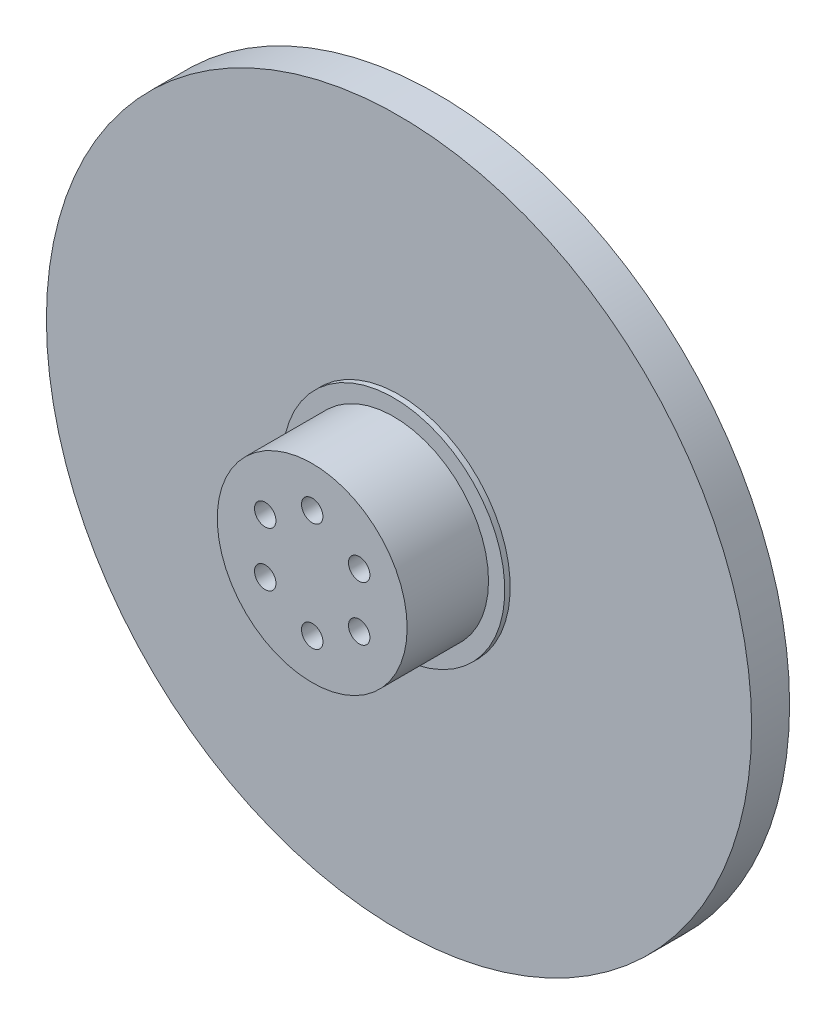
from build123d import *

# Parameters (mm, degrees)
SKETCH1_R           = 17.5
BOSS_EXTRUDE1_DEPTH = 15
SKETCH7_R           = 20.5
BOSS_EXTRUDE3_DEPTH = 1
SKETCH3_R           = 65
BOSS_EXTRUDE2_DEPTH = 7
SKETCH4_R           = 11
CUT_EXTRUDE1_DEPTH  = 7
SKETCH5_R           = 7.5
CUT_EXTRUDE2_DEPTH  = 0.5
SKETCH6_R           = 1.975
CUT_EXTRUDE3_DEPTH  = 6
CIRPATTERN1_COUNT   = 6


with BuildPart() as part:
    # Sketch1 → Boss-Extrude1 (new body)
    with BuildSketch(Plane.XY):
        Circle(SKETCH1_R)
    extrude(amount=BOSS_EXTRUDE1_DEPTH)

    # Sketch7 → Boss-Extrude3 (add)
    with BuildSketch(Plane(origin=(0, 0, 0), x_dir=(-1, 0, 0), z_dir=(0, 0, -1))):
        Circle(SKETCH7_R)
    extrude(amount=BOSS_EXTRUDE3_DEPTH)

    # Sketch3 → Boss-Extrude2 (add)
    with BuildSketch(Plane(origin=(0, 0, -1), x_dir=(-1, 0, 0), z_dir=(0, 0, -1))):
        Circle(SKETCH3_R)
    extrude(amount=BOSS_EXTRUDE2_DEPTH)

    # Sketch4 → Cut-Extrude1 (cut)
    with BuildSketch(Plane(origin=(0, 0, -8), x_dir=(-1, 0, 0), z_dir=(0, 0, -1))):
        Circle(SKETCH4_R)
    extrude(amount=-CUT_EXTRUDE1_DEPTH, mode=Mode.SUBTRACT)

    # Sketch5 → Cut-Extrude2 (cut)
    with BuildSketch(Plane(origin=(0, 0, -1), x_dir=(-1, 0, 0), z_dir=(0, 0, -1))):
        Circle(SKETCH5_R)
    extrude(amount=-CUT_EXTRUDE2_DEPTH, mode=Mode.SUBTRACT)

    # Sketch6 → Cut-Extrude3 (cut)
    with BuildSketch(Plane.XY.offset(15)):
        with Locations((0, 10)):
            Circle(SKETCH6_R)
    cut_extrude3 = extrude(amount=-CUT_EXTRUDE3_DEPTH, mode=Mode.SUBTRACT)

    # CirPattern1: Cut-Extrude3 ×6 about axis
    cirpattern1_axis = Axis((0, 0, 15), (0, 0, 1))
    for i in range(1, CIRPATTERN1_COUNT):
        add(cut_extrude3.rotate(cirpattern1_axis, i * 360 / CIRPATTERN1_COUNT), mode=Mode.SUBTRACT)


solid = part.part
